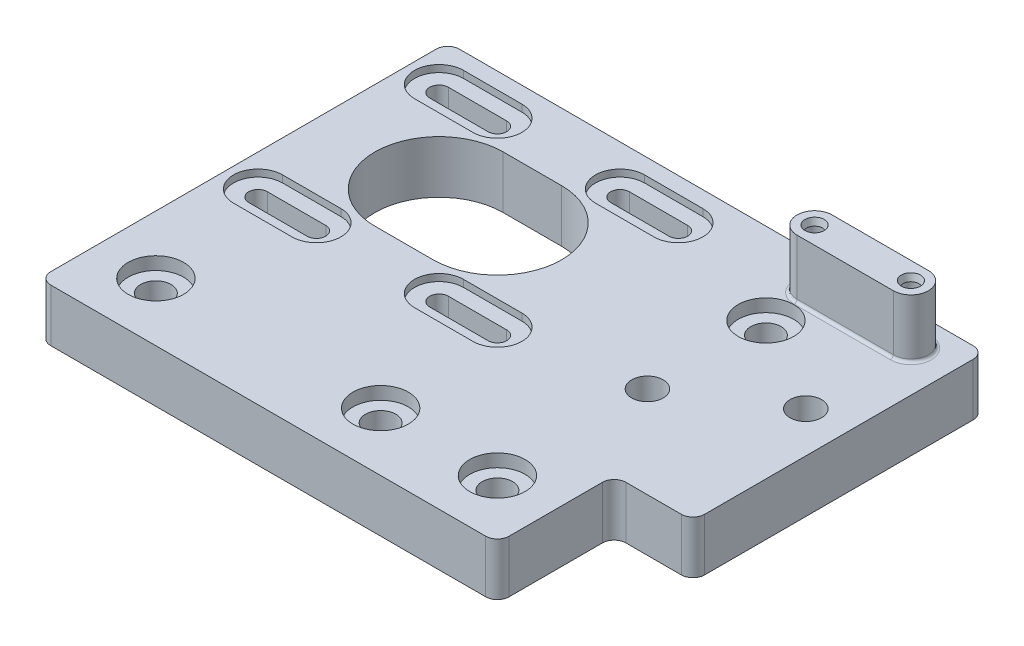
from build123d import *

# Parameters (mm, degrees)
SKETCH3_R           = 2.6
SKETCH3_R_2         = 2.7
BOSS_EXTRUDE1_DEPTH = 9
SKETCH5_R           = 4.75
CUT_EXTRUDE2_DEPTH  = 2.2
FILLET1_R           = 2
SKETCH7_R           = 1.35
BOSS_EXTRUDE2_DEPTH = 10
FILLET2_R           = 0.5
CHAMFER1_SIZE       = 0.3
CHAMFER1_SIZE2      = 1.119615242
CUT_EXTRUDE4_DEPTH  = 1.2
CUT_EXTRUDE7_DEPTH  = 0.4


# Read off the part's stored shape, not the designer's step: Cut-Extrude7
with BuildPart() as part:
    # Sketch3 → Boss-Extrude1 (new body)
    with BuildSketch(Plane(origin=(0, 0, 0), x_dir=(1, 0, 0), z_dir=(0, 1, 0))):
        Polygon((0, 0), (78.5, 0), (78.5, 70), (0, 70), (-13.5, 70), (-13.5, 20), (0, 20), align=None)
        with Locations(Location((10, 56, 0), (0, 0, 270))):
            Circle(SKETCH3_R, mode=Mode.SUBTRACT)
        with Locations(Location((10, 10, 0), (0, 0, 270))):
            Circle(SKETCH3_R, mode=Mode.SUBTRACT)
        with Locations(Location((68.5, 10, 0), (0, 0, 270))):
            Circle(SKETCH3_R, mode=Mode.SUBTRACT)
        with Locations(Location((10, 35.7, 0), (0, 0, 270))):
            Circle(SKETCH3_R_2, mode=Mode.SUBTRACT)
        with Locations(Location((-6.5, 46.325, 0), (0, 0, 270))):
            Circle(SKETCH3_R_2, mode=Mode.SUBTRACT)
        with Locations(Location((30, 10, 0), (0, 0, 270))):
            Circle(SKETCH3_R, mode=Mode.SUBTRACT)
        with BuildLine():
            Line((47.5, 58.5), (57.5, 58.5))
            ThreePointArc((57.5, 58.5), (68.5, 47.5), (57.5, 36.5))
            Line((57.5, 36.5), (47.5, 36.5))
            ThreePointArc((47.5, 36.5), (36.5, 47.5), (47.5, 58.5))
        make_face(mode=Mode.SUBTRACT)
        with BuildLine():
            Line((32, 64.6), (42, 64.6))
            ThreePointArc((42, 64.6), (43.6, 63), (42, 61.4))
            Line((42, 61.4), (32, 61.4))
            ThreePointArc((32, 61.4), (30.4, 63), (32, 64.6))
        make_face(mode=Mode.SUBTRACT)
        with BuildLine():
            Line((63, 64.6), (73, 64.6))
            ThreePointArc((73, 64.6), (74.6, 63), (73, 61.4))
            Line((73, 61.4), (63, 61.4))
            ThreePointArc((63, 61.4), (61.4, 63), (63, 64.6))
        make_face(mode=Mode.SUBTRACT)
        with BuildLine():
            Line((63, 33.6), (73, 33.6))
            ThreePointArc((73, 33.6), (74.6, 32), (73, 30.4))
            Line((73, 30.4), (63, 30.4))
            ThreePointArc((63, 30.4), (61.4, 32), (63, 33.6))
        make_face(mode=Mode.SUBTRACT)
        with BuildLine():
            Line((32, 33.6), (42, 33.6))
            ThreePointArc((42, 33.6), (43.6, 32), (42, 30.4))
            Line((42, 30.4), (32, 30.4))
            ThreePointArc((32, 30.4), (30.4, 32), (32, 33.6))
        make_face(mode=Mode.SUBTRACT)
    extrude(amount=BOSS_EXTRUDE1_DEPTH)

    # Sketch5 → Cut-Extrude2 (cut)
    with BuildSketch(Plane(origin=(0, 9, 0), x_dir=(1, 0, 0), z_dir=(0, 1, 0))):
        with Locations(Location((10, 56, 0), (0, 0, 270))):
            Circle(SKETCH5_R)
        with Locations(Location((10, 10, 0), (0, 0, 270))):
            Circle(SKETCH5_R)
        with Locations(Location((30, 10, 0), (0, 0, 270))):
            Circle(SKETCH5_R)
        with Locations(Location((68.5, 10, 0), (0, 0, 270))):
            Circle(SKETCH5_R)
    extrude(amount=-CUT_EXTRUDE2_DEPTH, mode=Mode.SUBTRACT)

    # Fillet1
    fillet1_edges = [part.edges().sort_by_distance(p)[0] for p in [
        (0, 4.5, -20),
        (-13.5, 4.5, -20),
        (-13.5, 4.5, -70),
        (78.5, 4.5, -70),
        (78.5, 4.5, 0),
        (0, 4.5, 0),
    ]]
    fillet(fillet1_edges, radius=FILLET1_R)

    # Sketch7 → Boss-Extrude2 (add)
    with BuildSketch(Plane(origin=(0, 9, 0), x_dir=(1, 0, 0), z_dir=(0, 1, 0))):
        with BuildLine():
            Line((-6.5, 67.325), (10, 67.325))
            ThreePointArc((10, 67.325), (13, 64.325), (10, 61.325))
            Line((10, 61.325), (-6.5, 61.325))
            ThreePointArc((-6.5, 61.325), (-9.5, 64.325), (-6.5, 67.325))
        make_face()
        with Locations(Location((-6.5, 64.325, 0), (0, 0, 270))):
            Circle(SKETCH7_R, mode=Mode.SUBTRACT)
        with Locations(Location((10, 64.325, 0), (0, 0, 270))):
            Circle(SKETCH7_R, mode=Mode.SUBTRACT)
    extrude(amount=BOSS_EXTRUDE2_DEPTH)

    # Fillet2
    fillet2_edges = [part.edges().sort_by_distance(p)[0] for p in [
        (-9.5, 9, -64.325),
        (1.75, 9, -61.325),
        (13, 9, -64.325),
        (1.75, 9, -67.325),
    ]]
    fillet(fillet2_edges, radius=FILLET2_R)

    # Chamfer1
    chamfer1_edges = [part.edges().sort_by_distance(p)[0] for p in [
        (-6.5, 19, -65.675),
        (10, 19, -65.675),
    ]]
    chamfer1_side = [part.faces().sort_by_distance(p)[0] for p in [
        (1.75, 19, -64.325),
    ]]
    chamfer(chamfer1_edges, length=CHAMFER1_SIZE, length2=CHAMFER1_SIZE2, reference=chamfer1_side[0])

    # Sketch8 → Cut-Extrude4 (cut)
    with BuildSketch(Plane(origin=(0, 9, 0), x_dir=(1, 0, 0), z_dir=(0, 1, 0))):
        with BuildLine():
            Line((73, 27.8), (63, 27.8))
            ThreePointArc((63, 27.8), (58.8, 32), (63, 36.2))
            Line((63, 36.2), (73, 36.2))
            ThreePointArc((73, 36.2), (77.2, 32), (73, 27.8))
        make_face()
        with BuildLine():
            Line((42, 27.8), (32, 27.8))
            ThreePointArc((32, 27.8), (27.8, 32), (32, 36.2))
            Line((32, 36.2), (42, 36.2))
            ThreePointArc((42, 36.2), (46.2, 32), (42, 27.8))
        make_face()
        with BuildLine():
            Line((42, 58.8), (32, 58.8))
            ThreePointArc((32, 58.8), (27.8, 63), (32, 67.2))
            Line((32, 67.2), (42, 67.2))
            ThreePointArc((42, 67.2), (46.2, 63), (42, 58.8))
        make_face()
        with BuildLine():
            Line((63, 67.2), (73, 67.2))
            ThreePointArc((73, 67.2), (77.2, 63), (73, 58.8))
            Line((73, 58.8), (63, 58.8))
            ThreePointArc((63, 58.8), (58.8, 63), (63, 67.2))
        make_face()
    extrude(amount=-CUT_EXTRUDE4_DEPTH, mode=Mode.SUBTRACT)


with BuildPart() as body_2:
    # Mirror1: mirrored copy
    add(part.part.mirror(Plane(origin=(78.5, 9, 0), x_dir=(0, 0, 1), z_dir=(-1, 0, 0))))

    # Cut-Extrude7 outline → Cut-Extrude7 (cut)
    # profile 1 of 5: a face of its own
    with BuildSketch(Plane(origin=(0, 0, 0), x_dir=(1, 0, 0), z_dir=(0, 1, 0))):
        with BuildLine():
            add(Edge.make_bspline(
                [(164.574238782, 62.070192308), (164.61757125, 62.069050737), (164.702971223, 62.066800922), (164.828098688, 62.046569103), (164.949266722, 62.016844546), (165.06497717, 61.971029822), (165.177505832, 61.915985118), (165.283431485, 61.845661449), (165.386364882, 61.765299962), (165.482776521, 61.67208458), (165.571104554, 61.56975141), (165.64934229, 61.461626903), (165.714727972, 61.347236916), (165.768328199, 61.227058163), (165.810374994, 61.101427164), (165.839509837, 60.970100536), (165.857802346, 60.833441255), (165.860277343, 60.740126198), (165.861538462, 60.692578125)],
                knots=[0, 0, 0, 0, 0.061969039, 0.122129076, 0.180999124, 0.240162417, 0.299864723, 0.359951267, 0.421741789, 0.486545679, 0.551508471, 0.614994937, 0.677239666, 0.73971468, 0.803038538, 0.866487293, 0.93196948, 1, 1, 1, 1], degree=3))
            add(Edge.make_bspline(
                [(165.861538462, 60.692578125), (165.860241581, 60.642919394), (165.857694722, 60.545397845), (165.839868037, 60.402219298), (165.809143701, 60.265618005), (165.767021289, 60.135317447), (165.713988837, 60.011192079), (165.646660147, 59.894364244), (165.567663978, 59.783767341), (165.477612658, 59.679604499), (165.376879584, 59.583895189), (165.265970907, 59.498036162), (165.144165179, 59.424807487), (165.014213623, 59.359893563), (164.872660991, 59.310224804), (164.722937428, 59.267768427), (164.562915719, 59.236927008), (164.452664386, 59.226286991), (164.396153846, 59.220833333)],
                knots=[0, 0, 0, 0, 0.064450804, 0.126570737, 0.18692234, 0.245923829, 0.304098129, 0.361780924, 0.420576707, 0.480272295, 0.540223572, 0.600657929, 0.661916152, 0.724434637, 0.788852535, 0.856286704, 0.926338162, 1, 1, 1, 1], degree=3))
            Line((164.396153846, 59.220833333), (164.396153846, 58.650961538))
            add(Edge.make_bspline(
                [(164.396153846, 58.650961538), (164.471757115, 58.654675027), (164.620239924, 58.661968219), (164.836722309, 58.696137061), (165.043669386, 58.744983133), (165.239306965, 58.814209414), (165.425972099, 58.899697822), (165.601186092, 59.004360372), (165.766687922, 59.125965829), (165.919344091, 59.264291102), (166.058890915, 59.414386772), (166.180671968, 59.575353532), (166.282387812, 59.745536949), (166.367882326, 59.923460924), (166.431978419, 60.1111832), (166.479557558, 60.306909363), (166.508178831, 60.511524076), (166.511255681, 60.650933673), (166.512820513, 60.721834936)],
                knots=[0, 0, 0, 0, 0.068798517, 0.135118456, 0.199001011, 0.261933701, 0.323531284, 0.385434721, 0.447215516, 0.510018103, 0.57251091, 0.633364022, 0.693216728, 0.752555388, 0.812558227, 0.873260859, 0.935542708, 1, 1, 1, 1], degree=3))
            add(Edge.make_bspline(
                [(166.512820513, 60.721834936), (166.511190456, 60.791463727), (166.507987453, 60.928281816), (166.480481014, 61.127965756), (166.437399726, 61.318061705), (166.376956043, 61.498198081), (166.295704296, 61.666937655), (166.19810019, 61.825548036), (166.085215639, 61.975917507), (165.952312291, 62.111275529), (165.810430822, 62.235568758), (165.658959912, 62.342797136), (165.50251535, 62.434623875), (165.339904185, 62.51116438), (165.169595319, 62.567509089), (164.994068251, 62.610286695), (164.811506094, 62.634466431), (164.687941343, 62.638177414), (164.625120192, 62.640064103)],
                knots=[0, 0, 0, 0, 0.06947546, 0.136516798, 0.200788824, 0.263829673, 0.325735023, 0.387290692, 0.449509219, 0.51296782, 0.576275215, 0.6375801, 0.697902606, 0.757172088, 0.816598528, 0.876653171, 0.937289642, 1, 1, 1, 1], degree=3))
            add(Edge.make_bspline(
                [(164.625120192, 62.640064103), (164.536677692, 62.63699204), (164.361344733, 62.630901825), (164.103689197, 62.578805742), (163.854055422, 62.497441357), (163.653146317, 62.399474724), (163.491251264, 62.300646147), (163.357958042, 62.211587383), (163.214438121, 62.107329798), (163.061172094, 61.986355951), (162.896959452, 61.851168312), (162.721899395, 61.700542387), (162.537800613, 61.53340407), (162.41206045, 61.416095075), (162.346905048, 61.355308494)],
                knots=[0, 0, 0, 0, 0.098702196, 0.195672309, 0.292422427, 0.391342544, 0.444462441, 0.504228775, 0.570352338, 0.642545753, 0.722287505, 0.807921123, 0.900469538, 1, 1, 1, 1], degree=3))
            Line((162.346905048, 61.355308494), (160.651282051, 59.766536458))
            Line((160.651282051, 59.766536458), (160.651282051, 62.721474359))
            Line((160.651282051, 62.721474359), (160, 62.721474359))
            Line((160, 62.721474359), (160, 58.406730769))
            Line((160, 58.406730769), (162.62802484, 60.869391026))
            add(Edge.make_bspline(
                [(162.62802484, 60.869391026), (162.690611211, 60.92935358), (162.810826821, 61.044529374), (162.986391104, 61.207364771), (163.149073271, 61.353852394), (163.299594204, 61.484089415), (163.43710059, 61.598182992), (163.562670034, 61.695768078), (163.675224936, 61.77727598), (163.807449729, 61.863657372), (163.969079963, 61.94602776), (164.16560701, 62.018422904), (164.368363586, 62.062249938), (164.505338983, 62.067534252), (164.574238782, 62.070192308)],
                knots=[0, 0, 0, 0, 0.110794173, 0.212812933, 0.30607791, 0.390617458, 0.467232727, 0.534450618, 0.593866801, 0.644832969, 0.736220619, 0.825037402, 0.911992313, 1, 1, 1, 1], degree=3))
        make_face()
    # profile 2 of 5: a face of its own
    with BuildSketch(Plane(origin=(0, 0, 0), x_dir=(1, 0, 0), z_dir=(0, 1, 0))):
        with BuildLine():
            add(Edge.make_bspline(
                [(163.172455929, 57.836858974), (163.075348631, 57.835675353), (162.88613902, 57.833369114), (162.609399234, 57.821453647), (162.348163265, 57.797872068), (162.101703931, 57.768705377), (161.871484541, 57.727157828), (161.655315986, 57.679925586), (161.455063767, 57.62122098), (161.268702053, 57.555209617), (161.096863533, 57.479359094), (160.935473414, 57.398144041), (160.785401938, 57.308755743), (160.645186751, 57.213748776), (160.516276711, 57.111797581), (160.398353222, 57.003049612), (160.291494065, 56.887422094), (160.195894784, 56.76519987), (160.112290426, 56.637436145), (160.037561576, 56.506869145), (159.976923749, 56.370892868), (159.925726055, 56.232529278), (159.88586365, 56.090472824), (159.85857013, 55.944862845), (159.839375091, 55.796176207), (159.837913889, 55.695661211), (159.837179487, 55.645142228)],
                knots=[0, 0, 0, 0, 0.065054434, 0.126755912, 0.185490514, 0.24073191, 0.29293992, 0.342140701, 0.388881863, 0.432635575, 0.474482647, 0.514623441, 0.553593506, 0.591408872, 0.628005603, 0.663582889, 0.698758803, 0.733361246, 0.767393593, 0.800968901, 0.834019894, 0.866998799, 0.89973339, 0.932711072, 0.966180487, 1, 1, 1, 1], degree=3))
            add(Edge.make_bspline(
                [(159.837179487, 55.645142228), (159.838029676, 55.595061685), (159.839706083, 55.496312631), (159.856907678, 55.349968647), (159.884957684, 55.207605793), (159.923049453, 55.068939476), (159.971461832, 54.933685912), (160.033040586, 54.803170044), (160.10446236, 54.675668206), (160.185717993, 54.551762192), (160.278834834, 54.433813578), (160.381819293, 54.321146586), (160.497254432, 54.216606015), (160.623292535, 54.119269038), (160.758864166, 54.026901532), (160.905304809, 53.941476195), (161.063567328, 53.864631341), (161.232458806, 53.792313199), (161.416028139, 53.728564894), (161.616043297, 53.672679511), (161.833610713, 53.626091227), (162.068084497, 53.588624687), (162.319640143, 53.557737295), (162.588720562, 53.536828111), (162.875093601, 53.523856288), (163.071526369, 53.522706275), (163.172455929, 53.522115385)],
                knots=[0, 0, 0, 0, 0.033789202, 0.066625711, 0.099290918, 0.131644991, 0.163601723, 0.19612244, 0.228922763, 0.262180588, 0.296015812, 0.330244518, 0.365088617, 0.400981712, 0.437653588, 0.475743052, 0.51529147, 0.556326816, 0.599680742, 0.646342906, 0.696412977, 0.749766296, 0.80656154, 0.867427467, 0.93188261, 1, 1, 1, 1], degree=3))
            add(Edge.make_bspline(
                [(163.172455929, 53.522115385), (163.274232619, 53.522710503), (163.471935304, 53.52386653), (163.760016012, 53.536726951), (164.030272537, 53.558090785), (164.28271781, 53.587368595), (164.517417026, 53.622997486), (164.733742894, 53.670559921), (164.932696913, 53.724648688), (165.114926947, 53.787337286), (165.282891208, 53.858070244), (165.439684665, 53.93506528), (165.585108257, 54.021336007), (165.721346634, 54.112099209), (165.846879311, 54.210671612), (165.96146856, 54.316013521), (166.065183571, 54.429169886), (166.159258729, 54.547902731), (166.241210184, 54.672962415), (166.315053893, 54.800493764), (166.37566194, 54.932747173), (166.425462305, 55.068516448), (166.465366075, 55.207406759), (166.492999358, 55.349991989), (166.510317999, 55.496306585), (166.511978427, 55.595059651), (166.512820513, 55.645142228)],
                knots=[0, 0, 0, 0, 0.068599052, 0.133254647, 0.194325134, 0.25129545, 0.304533104, 0.354257782, 0.40050645, 0.443439389, 0.484046125, 0.523286091, 0.561078603, 0.59793885, 0.633559399, 0.668550634, 0.702734162, 0.736926052, 0.770536038, 0.803433659, 0.836170733, 0.868451751, 0.900840135, 0.933462228, 0.966255396, 1, 1, 1, 1], degree=3))
            add(Edge.make_bspline(
                [(166.512820513, 55.645142228), (166.511935477, 55.695643739), (166.510175418, 55.796075355), (166.493259123, 55.944557178), (166.465190085, 56.089608744), (166.425419174, 56.230611653), (166.376078446, 56.368724128), (166.314234677, 56.502865896), (166.242245875, 56.633870173), (166.15765684, 56.759655123), (166.063346139, 56.881601639), (165.956733868, 56.996714372), (165.838896521, 57.1050038), (165.711094853, 57.207828996), (165.570877628, 57.302272723), (165.4206836, 57.392213093), (165.257886174, 57.472716644), (165.085201611, 57.550249554), (164.89785183, 57.617173087), (164.696892907, 57.677527561), (164.479951168, 57.72629369), (164.248164837, 57.766914227), (164.000682689, 57.798382823), (163.738035231, 57.821302046), (163.460049665, 57.833408928), (163.269988996, 57.835688943), (163.172455929, 57.836858974)],
                knots=[0, 0, 0, 0, 0.033788116, 0.067193932, 0.099862411, 0.132566612, 0.165151173, 0.197913187, 0.231319004, 0.265083278, 0.299255309, 0.334398567, 0.369942824, 0.406283561, 0.44406382, 0.482997707, 0.523354447, 0.56553659, 0.609612924, 0.656390811, 0.705885495, 0.7583245, 0.813831783, 0.872794559, 0.93472223, 1, 1, 1, 1], degree=3))
        make_face()
        with BuildLine():
            add(Edge.make_bspline(
                [(163.175, 57.266987179), (163.251333302, 57.266189213), (163.40067603, 57.264628027), (163.619164575, 57.254370894), (163.827044238, 57.237888532), (164.024503601, 57.215580018), (164.211191208, 57.184955146), (164.387374207, 57.148177723), (164.5530051, 57.105060414), (164.708511036, 57.055603575), (164.853333084, 56.999866402), (164.987786551, 56.938293538), (165.11258423, 56.87258695), (165.227367902, 56.801206369), (165.332655676, 56.725014834), (165.426335543, 56.641997406), (165.511311195, 56.555448084), (165.608307567, 56.434222606), (165.707207359, 56.275519257), (165.79822238, 56.078042153), (165.850488854, 55.872536841), (165.857857915, 55.733610717), (165.861538462, 55.664222756)],
                knots=[0, 0, 0, 0, 0.065683432, 0.128506729, 0.18816731, 0.245100247, 0.29944439, 0.350894442, 0.39992127, 0.446652922, 0.491237229, 0.533360472, 0.57383826, 0.612513132, 0.649585218, 0.685521345, 0.720096266, 0.75382929, 0.818919257, 0.880489397, 0.940309304, 1, 1, 1, 1], degree=3))
            add(Edge.make_bspline(
                [(165.861538462, 55.664222756), (165.857857585, 55.593987733), (165.850489127, 55.453389735), (165.798359436, 55.24579312), (165.70805473, 55.046909292), (165.607668906, 54.889479205), (165.513028304, 54.768406676), (165.430728478, 54.682912567), (165.34020587, 54.602984477), (165.242298931, 54.527761043), (165.136131127, 54.458576867), (165.021186196, 54.39678148), (164.898533417, 54.339283726), (164.766755368, 54.286487484), (164.622143206, 54.240660297), (164.463513273, 54.199699245), (164.287781483, 54.167593507), (164.096475954, 54.139576679), (163.888932576, 54.118215437), (163.665314906, 54.103650588), (163.425699907, 54.092604604), (163.260240362, 54.09219711), (163.175, 54.091987179)],
                knots=[0, 0, 0, 0, 0.060398231, 0.120906492, 0.182789759, 0.247550248, 0.281044758, 0.314839779, 0.349461206, 0.384842799, 0.420959358, 0.458335795, 0.497006764, 0.537441863, 0.580351082, 0.627413762, 0.678274955, 0.73393207, 0.793707046, 0.857686313, 0.92668377, 1, 1, 1, 1], degree=3))
            add(Edge.make_bspline(
                [(163.175, 54.091987179), (163.090184504, 54.092203891), (162.925574279, 54.092624484), (162.686372935, 54.103612163), (162.463269623, 54.118580439), (162.255981068, 54.137886798), (162.065208887, 54.166557845), (161.889641085, 54.198683073), (161.730206502, 54.237777279), (161.585812023, 54.284033137), (161.454003985, 54.336716271), (161.331362603, 54.39424705), (161.216400954, 54.456017157), (161.11028667, 54.525267998), (161.011963456, 54.600428813), (160.921713867, 54.681623023), (160.839931684, 54.768707829), (160.742889196, 54.889261749), (160.641422531, 55.0476316), (160.554153452, 55.248195144), (160.498955479, 55.454373087), (160.491955463, 55.594353962), (160.488461538, 55.664222756)],
                knots=[0, 0, 0, 0, 0.072955804, 0.14159289, 0.205939835, 0.265318588, 0.320618055, 0.371840652, 0.418816969, 0.461728715, 0.502166195, 0.540839439, 0.578218077, 0.614336762, 0.649720438, 0.684587067, 0.718648771, 0.752372873, 0.817640596, 0.879714265, 0.939961661, 1, 1, 1, 1], degree=3))
            add(Edge.make_bspline(
                [(160.488461538, 55.664222756), (160.491360369, 55.734540246), (160.497152046, 55.875030047), (160.553029755, 56.080287075), (160.637338777, 56.279550565), (160.737029251, 56.435709657), (160.831967792, 56.5545137), (160.912911511, 56.639634525), (161.003545727, 56.717761384), (161.10133445, 56.791860577), (161.208145957, 56.859822043), (161.323466629, 56.921622307), (161.447616709, 56.978016381), (161.534284664, 57.01014565), (161.578595753, 57.026572516)],
                knots=[0, 0, 0, 0, 0.112813401, 0.225393884, 0.339594815, 0.45967541, 0.52173519, 0.583925839, 0.648174145, 0.713881038, 0.781004455, 0.851450928, 0.924050693, 1, 1, 1, 1], degree=3))
            add(Edge.make_bspline(
                [(161.578595753, 57.026572516), (161.635255423, 57.045716438), (161.750298853, 57.084586808), (161.928758622, 57.134682456), (162.115997922, 57.174134823), (162.310897776, 57.209628358), (162.51489552, 57.233854617), (162.727359959, 57.253354221), (162.948451288, 57.264839896), (163.098665057, 57.266263658), (163.175, 57.266987179)],
                knots=[0, 0, 0, 0, 0.110588339, 0.224541754, 0.342503494, 0.464324098, 0.590756033, 0.722227475, 0.858842836, 1, 1, 1, 1], degree=3))
        make_face(mode=Mode.SUBTRACT)
    # profile 3 of 5: a face of its own
    with BuildSketch(Plane(origin=(0, 0, 0), x_dir=(1, 0, 0), z_dir=(0, 1, 0))):
        with BuildLine():
            Line((166.35, 38.087820513), (166.35, 39.333143029))
            add(Edge.make_bspline(
                [(166.35, 39.333143029), (166.349905845, 39.418797101), (166.349725441, 39.582914108), (166.344255831, 39.818254281), (166.336950261, 40.031994794), (166.326823112, 40.223674771), (166.314855012, 40.393883977), (166.298069169, 40.541852221), (166.280542633, 40.668742559), (166.262723796, 40.744772831), (166.254597356, 40.779447115)],
                knots=[0, 0, 0, 0, 0.176955752, 0.33905508, 0.486318225, 0.618780923, 0.735618828, 0.838742477, 0.926457068, 1, 1, 1, 1], degree=3))
            add(Edge.make_bspline(
                [(166.254597356, 40.779447115), (166.242583354, 40.823341202), (166.218838445, 40.910095065), (166.17127771, 41.035099744), (166.114891539, 41.154038715), (166.050601109, 41.267286825), (165.97577598, 41.373574953), (165.892783087, 41.474263657), (165.801668088, 41.569930458), (165.700664653, 41.657325585), (165.593496748, 41.73778402), (165.477777685, 41.806805151), (165.356026046, 41.865187917), (165.226994946, 41.912868854), (165.091468601, 41.949124759), (164.949051367, 41.975911767), (164.800232602, 41.993050426), (164.698521818, 41.994682165), (164.646744792, 41.995512821)],
                knots=[0, 0, 0, 0, 0.062467952, 0.123463925, 0.183371798, 0.243101125, 0.302062005, 0.361632175, 0.422170615, 0.483247137, 0.544854287, 0.605969656, 0.667955391, 0.730042238, 0.794594939, 0.860375541, 0.928922588, 1, 1, 1, 1], degree=3))
            add(Edge.make_bspline(
                [(164.646744792, 41.995512821), (164.594533682, 41.994748236), (164.492379121, 41.993252274), (164.342931348, 41.975297585), (164.200113697, 41.951112808), (164.064242837, 41.913925299), (163.936125653, 41.865219578), (163.813804275, 41.808083996), (163.699359728, 41.73917102), (163.592376529, 41.659986829), (163.492754259, 41.571900365), (163.401214846, 41.47528432), (163.318294118, 41.370528746), (163.24380618, 41.257966563), (163.179478359, 41.136500409), (163.121861534, 41.007972502), (163.07347261, 40.871265681), (163.04801807, 40.776664262), (163.035076122, 40.728565705)],
                knots=[0, 0, 0, 0, 0.070118894, 0.137192353, 0.202016181, 0.264631407, 0.326116547, 0.386010305, 0.445811847, 0.505297697, 0.564633278, 0.624282625, 0.683902032, 0.743952771, 0.805387731, 0.868388031, 0.933084028, 1, 1, 1, 1], degree=3))
            add(Edge.make_bspline(
                [(163.035076122, 40.728565705), (163.026616142, 40.688783256), (163.008075604, 40.601597707), (162.987377404, 40.458010196), (162.969710614, 40.290832139), (162.956464264, 40.100291717), (162.94512431, 39.886559961), (162.936110768, 39.649521251), (162.931158033, 39.388710283), (162.930902595, 39.206789597), (162.930769231, 39.111808894)],
                knots=[0, 0, 0, 0, 0.075173117, 0.164746258, 0.268016881, 0.385911876, 0.517789479, 0.663690977, 0.824413221, 1, 1, 1, 1], degree=3))
            Line((162.930769231, 39.111808894), (162.930769231, 38.657692308))
            Line((162.930769231, 38.657692308), (160, 38.657692308))
            Line((160, 38.657692308), (160, 38.087820513))
            Line((160, 38.087820513), (166.35, 38.087820513))
        make_face()
        with BuildLine():
            add(Edge.make_bspline(
                [(163.568058894, 39.769451122), (163.568024948, 39.823734947), (163.567959415, 39.928528751), (163.575288958, 40.080321564), (163.583373934, 40.220789003), (163.596035354, 40.350236115), (163.612717965, 40.467673657), (163.630876668, 40.574610074), (163.655478097, 40.669479874), (163.689780877, 40.780649907), (163.7471447, 40.904106782), (163.832555244, 41.03752306), (163.938437074, 41.152421668), (164.05912079, 41.251185649), (164.193864616, 41.327727472), (164.336901476, 41.385296682), (164.488321373, 41.418830416), (164.59188769, 41.423355388), (164.644200721, 41.425641026)],
                knots=[0, 0, 0, 0, 0.072523007, 0.14000417, 0.203018225, 0.260521459, 0.313724644, 0.361511615, 0.405346608, 0.44458737, 0.516844318, 0.586460835, 0.655442756, 0.724726487, 0.794017168, 0.861666989, 0.930125746, 1, 1, 1, 1], degree=3))
            add(Edge.make_bspline(
                [(164.644200721, 41.425641026), (164.695248057, 41.423343183), (164.796723843, 41.418775357), (164.945515268, 41.385032171), (165.08703456, 41.327839853), (165.220119521, 41.25066699), (165.340309338, 41.154738838), (165.443801579, 41.04238649), (165.528129581, 40.915904106), (165.582182939, 40.798187468), (165.615241297, 40.693691739), (165.638361498, 40.60291722), (165.656823772, 40.500427708), (165.671772332, 40.386185945), (165.684569404, 40.261078615), (165.693252511, 40.124030508), (165.69833516, 39.975560905), (165.698587263, 39.872490297), (165.698717949, 39.819060497)],
                knots=[0, 0, 0, 0, 0.070034431, 0.13921978, 0.208169738, 0.278842073, 0.349646083, 0.41843128, 0.487677798, 0.557469994, 0.59538403, 0.638012249, 0.685954592, 0.73822002, 0.796129792, 0.858535379, 0.92666749, 1, 1, 1, 1], degree=3))
            Line((165.698717949, 39.819060497), (165.698717949, 38.657692308))
            Line((165.698717949, 38.657692308), (163.582051282, 38.657692308))
            Line((163.582051282, 38.657692308), (163.568058894, 39.769451122))
        make_face(mode=Mode.SUBTRACT)
    # profile 4 of 5: a face of its own
    with BuildSketch(Plane(origin=(0, 0, 0), x_dir=(1, 0, 0), z_dir=(0, 1, 0))):
        with BuildLine():
            Line((166.35, 24.655128205), (166.35, 25.925891426))
            add(Edge.make_bspline(
                [(166.35, 25.925891426), (166.349717723, 26.010693188), (166.349175719, 26.173521964), (166.346153549, 26.406790612), (166.337491503, 26.618748345), (166.330037359, 26.809284339), (166.316444837, 26.978395099), (166.303453377, 27.126599184), (166.286446878, 27.253214006), (166.270652754, 27.329860051), (166.263501603, 27.364563301)],
                knots=[0, 0, 0, 0, 0.176257755, 0.338434414, 0.484822051, 0.617157578, 0.734698361, 0.837385184, 0.926372421, 1, 1, 1, 1], degree=3))
            add(Edge.make_bspline(
                [(166.263501603, 27.364563301), (166.252024345, 27.411021852), (166.22931467, 27.502947866), (166.181290503, 27.635288257), (166.125807453, 27.761450901), (166.06013474, 27.880962348), (165.985417839, 27.993833683), (165.901220205, 28.099895908), (165.807113053, 28.198542634), (165.705499483, 28.290532901), (165.595492885, 28.373919117), (165.478695758, 28.446078977), (165.355838599, 28.507869103), (165.226493575, 28.557198018), (165.091754085, 28.596881619), (164.950443599, 28.624871787), (164.803193836, 28.641655376), (164.702758851, 28.643364269), (164.651832933, 28.644230769)],
                knots=[0, 0, 0, 0, 0.064210805, 0.127051819, 0.188726793, 0.24910868, 0.309897111, 0.370265578, 0.430668931, 0.492744591, 0.554114032, 0.615725916, 0.67682809, 0.73846364, 0.80133559, 0.865197187, 0.931647751, 1, 1, 1, 1], degree=3))
            add(Edge.make_bspline(
                [(164.651832933, 28.644230769), (164.567223431, 28.641565656), (164.40212838, 28.63636533), (164.162533569, 28.58787739), (163.939027982, 28.508457809), (163.731922661, 28.399001111), (163.545145539, 28.259676806), (163.381647967, 28.092240674), (163.243566818, 27.897547798), (163.14883098, 27.715450563), (163.087873881, 27.554519095), (163.044768934, 27.421641408), (163.012026562, 27.276584251), (162.982268321, 27.121428688), (162.959560392, 26.954976282), (162.943433447, 26.777562228), (162.933063698, 26.588742803), (162.931548634, 26.459312092), (162.930769231, 26.392728365)],
                knots=[0, 0, 0, 0, 0.078775142, 0.153710705, 0.226698871, 0.29917182, 0.371165996, 0.44297777, 0.516334013, 0.592857108, 0.63351018, 0.676623617, 0.722915422, 0.771971354, 0.823829257, 0.87938645, 0.937952132, 1, 1, 1, 1], degree=3))
            Line((162.930769231, 26.392728365), (160, 28.725641026))
            Line((160, 28.725641026), (160, 28.020933494))
            Line((160, 28.020933494), (162.930769231, 25.688020833))
            Line((162.930769231, 25.688020833), (162.930769231, 25.225))
            Line((162.930769231, 25.225), (160, 25.225))
            Line((160, 25.225), (160, 24.655128205))
            Line((160, 24.655128205), (166.35, 24.655128205))
        make_face()
        with BuildLine():
            add(Edge.make_bspline(
                [(163.573147035, 26.387640224), (163.57312302, 26.441923723), (163.573076473, 26.547140605), (163.580322321, 26.699360386), (163.588565207, 26.841092578), (163.601173279, 26.97179512), (163.617422239, 27.091526207), (163.637747368, 27.200226629), (163.66142847, 27.298071754), (163.698076067, 27.412192778), (163.756170655, 27.539587413), (163.840549734, 27.678209806), (163.947366939, 27.795857477), (164.067569473, 27.897292573), (164.202447804, 27.975423431), (164.346015189, 28.032288988), (164.497032166, 28.067975293), (164.600758225, 28.072217891), (164.653104968, 28.074358974)],
                knots=[0, 0, 0, 0, 0.071662971, 0.138903248, 0.201170031, 0.259105703, 0.312232476, 0.360655445, 0.40505687, 0.445069493, 0.518740291, 0.589418982, 0.658414658, 0.727587276, 0.796337206, 0.863184781, 0.930954371, 1, 1, 1, 1], degree=3))
            add(Edge.make_bspline(
                [(164.653104968, 28.074358974), (164.704185056, 28.072211309), (164.805407151, 28.067955421), (164.953186958, 28.032219844), (165.093661406, 27.974512112), (165.224152961, 27.893592516), (165.343591003, 27.795813596), (165.44437261, 27.679686589), (165.528771332, 27.551059793), (165.582311164, 27.430754104), (165.615201532, 27.323297307), (165.638317644, 27.229984771), (165.657046241, 27.124148831), (165.671607371, 27.006043128), (165.684710724, 26.875881334), (165.693206591, 26.733307042), (165.698341495, 26.578484892), (165.698589544, 26.471175005), (165.698717949, 26.415625)],
                knots=[0, 0, 0, 0, 0.068800096, 0.136336686, 0.203757018, 0.272787156, 0.342622324, 0.411089038, 0.479278287, 0.549403054, 0.587738712, 0.630724933, 0.678947097, 0.73255864, 0.791154526, 0.855313051, 0.925101397, 1, 1, 1, 1], degree=3))
            Line((165.698717949, 26.415625), (165.698717949, 25.225))
            Line((165.698717949, 25.225), (163.582051282, 25.225))
            Line((163.582051282, 25.225), (163.573147035, 26.387640224))
        make_face(mode=Mode.SUBTRACT)
    # profile 5 of 5: a face of its own
    with BuildSketch(Plane(origin=(0, 0, 0), x_dir=(1, 0, 0), z_dir=(0, 1, 0))):
        Polygon((160, 30.276252003), (160, 29.702564103), (166.35, 30.540835337), (166.35, 30.622245593), (161.13974359, 33.243910256), (166.35, 35.859214744), (166.35, 35.941897035), (160, 36.78525641), (160, 36.212840545), (164.569150641, 35.604807692), (160, 33.31260016), (160, 33.184124599), (164.579326923, 30.883012821), align=None)
    extrude(amount=CUT_EXTRUDE7_DEPTH, mode=Mode.SUBTRACT)


solid = body_2.part
